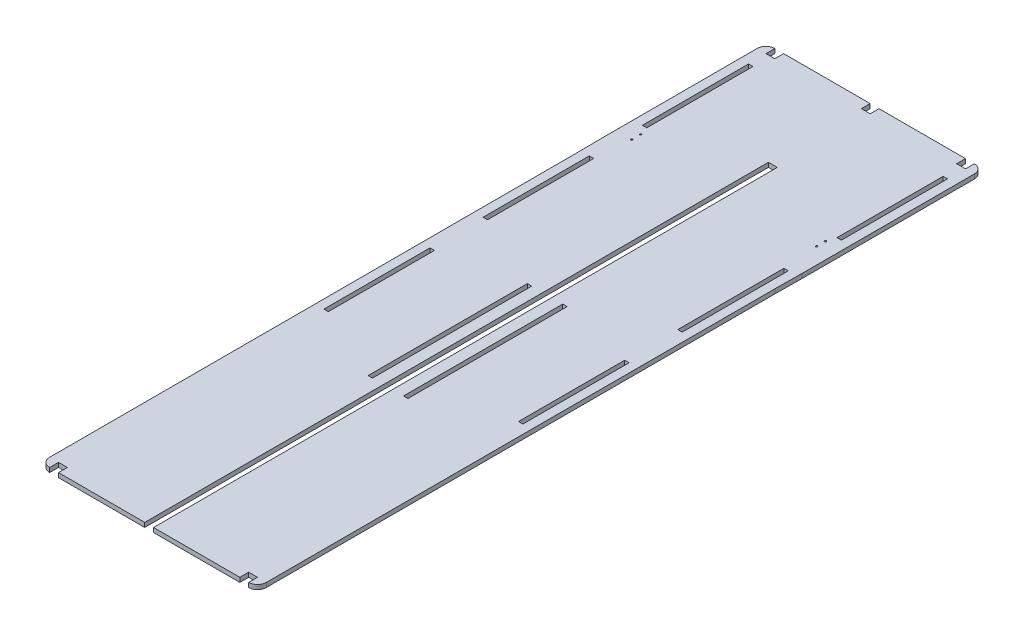
from build123d import *

# Parameters (mm, degrees)
SKETCH2_W           = 5
SKETCH2_H           = 120
BOSS_EXTRUDE1_DEPTH = 5
SKETCH3_R           = 1
SKETCH3_W           = 5
SKETCH3_H           = 180
CUT_EXTRUDE1_DEPTH  = 5
FILLET1_R           = 10
SKETCH4_W           = 10
SKETCH4_H           = 10
CUT_EXTRUDE2_DEPTH  = 10


with BuildPart() as part:
    # Sketch2 → Boss-Extrude1 (new body)
    with BuildSketch(Plane(origin=(0, 0, 0), x_dir=(1, 0, 0), z_dir=(0, 1, 0))):
        Polygon((0, 375), (0, 0), (0, -230), (10, -230), (15, -230), (117.5, -230), (117.5, 475), (127.5, 475), (127.5, -230), (230, -230), (235, -230), (245, -230), (245, -10), (245, 355), (245.3, 385), (245.3, 590), (245, 590), (0, 590), (-0.3, 590), (-0.3, 405), align=None)
        with Locations((12.5, 140)):
            Rectangle(SKETCH2_W, SKETCH2_H, mode=Mode.SUBTRACT)
        with Locations((232.5, 140)):
            Rectangle(SKETCH2_W, SKETCH2_H, mode=Mode.SUBTRACT)
        with Locations((12.5, 320)):
            Rectangle(SKETCH2_W, SKETCH2_H, mode=Mode.SUBTRACT)
        with Locations((12.5, 500)):
            Rectangle(SKETCH2_W, SKETCH2_H, mode=Mode.SUBTRACT)
        with Locations((232.5, 320)):
            Rectangle(SKETCH2_W, SKETCH2_H, mode=Mode.SUBTRACT)
        with Locations((232.5, 500)):
            Rectangle(SKETCH2_W, SKETCH2_H, mode=Mode.SUBTRACT)
    extrude(amount=BOSS_EXTRUDE1_DEPTH)

    # Sketch3 → Cut-Extrude1 (cut)
    with BuildSketch(Plane(origin=(0, 5, 0), x_dir=(1, 0, 0), z_dir=(0, 1, 0))):
        with Locations((18, 420)):
            Circle(SKETCH3_R)
        with Locations((18, 430)):
            Circle(SKETCH3_R)
        with Locations((102.5, 130)):
            Rectangle(SKETCH3_W, SKETCH3_H)
    cut_extrude1 = extrude(amount=-CUT_EXTRUDE1_DEPTH, mode=Mode.SUBTRACT)

    # Mirror1: Cut-Extrude1 across plane
    add(cut_extrude1.mirror(Plane.ZY.offset(-122.5)), mode=Mode.SUBTRACT)

    # Fillet1
    fillet1_edges = [part.edges().sort_by_distance(p)[0] for p in [
        (245.3, 2.5, -590),
        (-0.3, 2.5, -590),
        (0, 2.5, 230),
        (245, 2.5, 230),
    ]]
    fillet(fillet1_edges, radius=FILLET1_R)

    # Sketch4 → Cut-Extrude2 (cut)
    with BuildSketch(Plane(origin=(0, 5, 0), x_dir=(1, 0, 0), z_dir=(0, 1, 0))):
        with Locations((15, -225)):
            Rectangle(SKETCH4_W, SKETCH4_H)
        with Locations((230, -225)):
            Rectangle(SKETCH4_W, SKETCH4_H)
        with Locations((14.7, 585)):
            Rectangle(SKETCH4_W, SKETCH4_H)
        with Locations((230.3, 585)):
            Rectangle(SKETCH4_W, SKETCH4_H)
        with Locations((122.5, 585)):
            Rectangle(SKETCH4_W, SKETCH4_H)
    extrude(amount=-CUT_EXTRUDE2_DEPTH, mode=Mode.SUBTRACT)


solid = part.part
